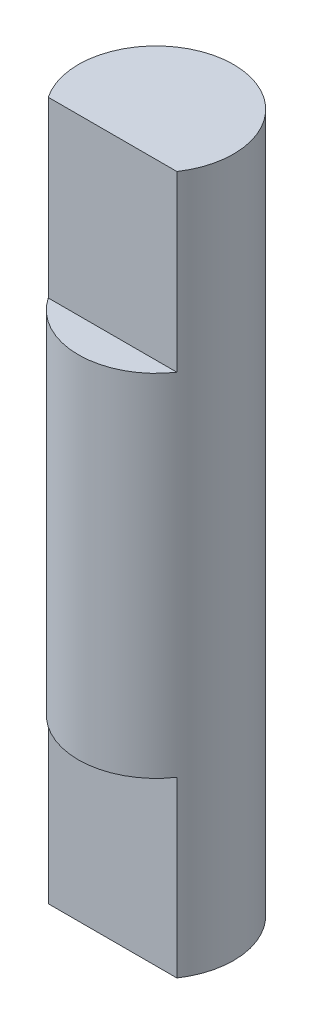
from build123d import *

# Parameters (mm, degrees)
SKETCH1_R           = 3.175
BOSS_EXTRUDE1_DEPTH = 28.575
CUT_EXTRUDE1_DEPTH  = 7.112
CUT_EXTRUDE2_DEPTH  = 7.112


with BuildPart() as part:
    # Sketch1 → Boss-Extrude1 (new body)
    with BuildSketch(Plane(origin=(0, 0, 0), x_dir=(1, 0, 0), z_dir=(0, 1, 0))):
        Circle(SKETCH1_R)
    extrude(amount=BOSS_EXTRUDE1_DEPTH)

    # Sketch2 → Cut-Extrude1 (cut)
    with BuildSketch(Plane(origin=(0, 28.575, 0), x_dir=(1, 0, 0), z_dir=(0, 1, 0))):
        Polygon((-2.630464028, -1.778), (2.630464028, -1.778), (2.777948751, -3.689189082), (-2.630464028, -3.689189082), align=None)
    extrude(amount=-CUT_EXTRUDE1_DEPTH, mode=Mode.SUBTRACT)

    # Sketch3 → Cut-Extrude2 (cut)
    with BuildSketch(Plane.XZ):
        Polygon((-2.630464028, 1.778), (2.630464028, 1.778), (2.491358847, 4.844067394), (-3.600848442, 3.874236118), align=None)
    extrude(amount=-CUT_EXTRUDE2_DEPTH, mode=Mode.SUBTRACT)


solid = part.part
